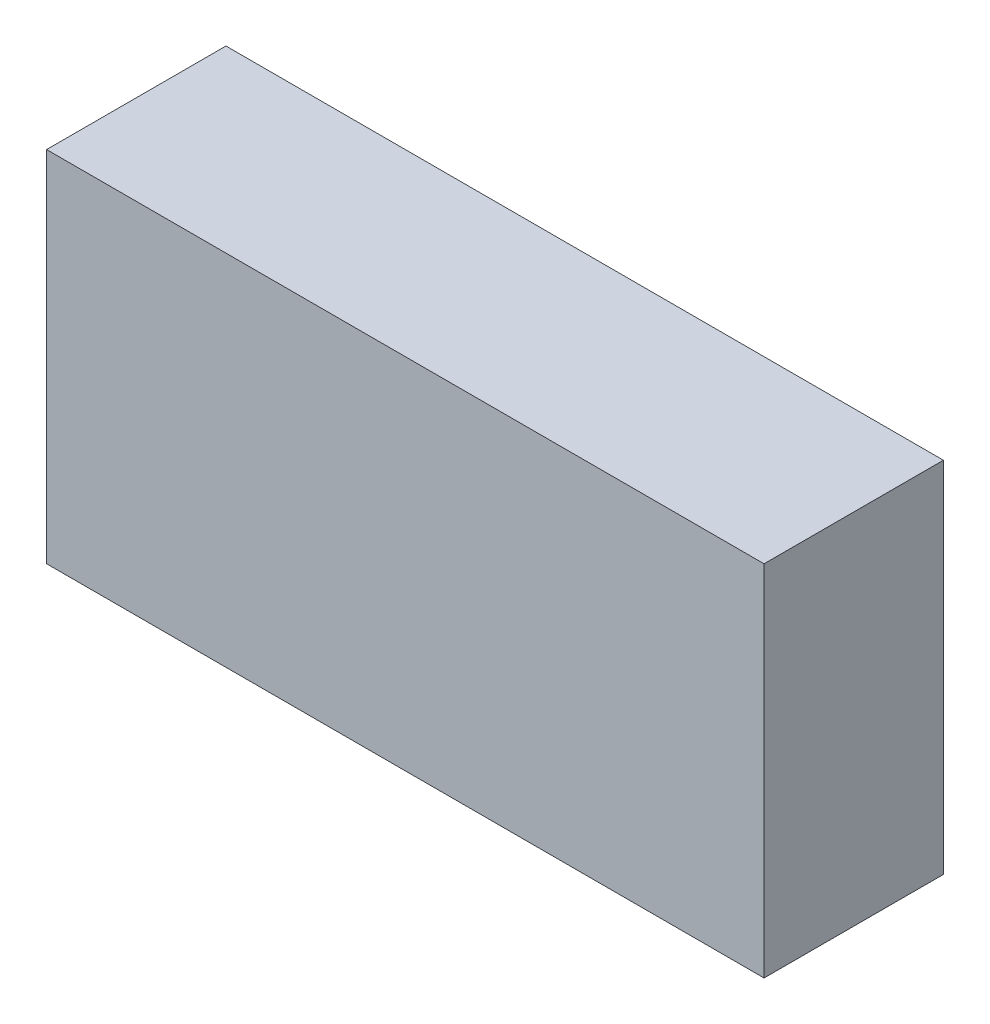
from build123d import *

# Parameters (mm, degrees)
SKETCH1_W           = 40
SKETCH1_H           = 20
BOSS_EXTRUDE1_DEPTH = 10


with BuildPart() as part:
    # Sketch1 → Boss-Extrude1 (new body)
    with BuildSketch(Plane.XY):
        with Locations((20, 10)):
            Rectangle(SKETCH1_W, SKETCH1_H)
    extrude(amount=BOSS_EXTRUDE1_DEPTH)


solid = part.part
